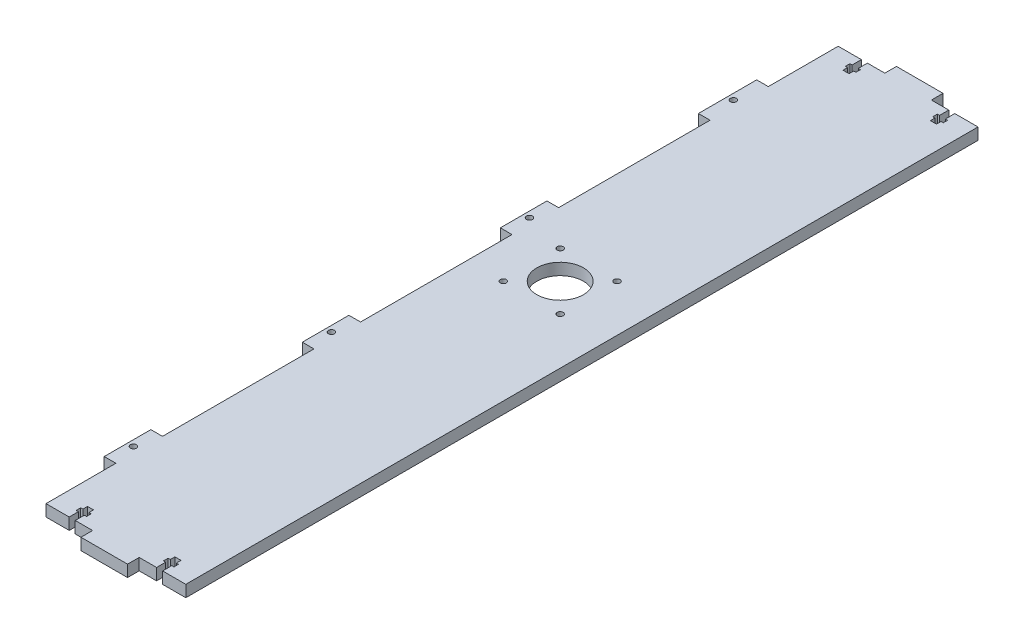
from build123d import *

# Parameters (mm, degrees)
SKETCH1_R           = 1.65
SKETCH1_R_2         = 12.7
BOSS_EXTRUDE1_DEPTH = 6.35


with BuildPart() as part:
    # Sketch1 → Boss-Extrude1 (new body)
    with BuildSketch(Plane.XZ.offset(-50.8)):
        Polygon((-350.52, 222.25), (-350.52, 215.9), (-359.9825, 215.9), (-359.9825, 210.9), (-358.7825, 210.9), (-358.7825, 208.4), (-359.9825, 208.4), (-359.9825, 205.9), (-363.2825, 205.9), (-363.2825, 208.4), (-364.4825, 208.4), (-364.4825, 210.9), (-363.2825, 210.9), (-363.2825, 215.9), (-375.92, 215.9), (-375.92, 177.8), (-382.27, 177.8), (-382.27, 152.4), (-375.92, 152.4), (-375.92, 69.85), (-382.27, 69.85), (-382.27, 44.45), (-375.92, 44.45), (-375.92, -38.1), (-382.27, -38.1), (-382.27, -63.5), (-375.92, -63.5), (-375.92, -146.05), (-382.27, -146.05), (-382.27, -177.8), (-375.92, -177.8), (-375.92, -215.9), (-363.2825, -215.9), (-363.2825, -210.9), (-364.4825, -210.9), (-364.4825, -208.4), (-363.2825, -208.4), (-363.2825, -205.9), (-359.9825, -205.9), (-359.9825, -208.4), (-358.7825, -208.4), (-358.7825, -210.9), (-359.9825, -210.9), (-359.9825, -215.9), (-350.52, -215.9), (-350.52, -222.25), (-325.12, -222.25), (-325.12, -215.9), (-315.6575, -215.9), (-315.6575, -210.9), (-316.8575, -210.9), (-316.8575, -208.4), (-315.6575, -208.4), (-315.6575, -205.9), (-312.3575, -205.9), (-312.3575, -208.4), (-311.1575, -208.4), (-311.1575, -210.9), (-312.3575, -210.9), (-312.3575, -215.9), (-299.72, -215.9), (-299.72, 215.9), (-312.3575, 215.9), (-312.3575, 210.9), (-311.1575, 210.9), (-311.1575, 208.4), (-312.3575, 208.4), (-312.3575, 205.9), (-315.6575, 205.9), (-315.6575, 208.4), (-316.8575, 208.4), (-316.8575, 210.9), (-315.6575, 210.9), (-315.6575, 215.9), (-325.12, 215.9), (-325.12, 222.25), align=None)
        with Locations((-379.095, 165.1)):
            Circle(SKETCH1_R, mode=Mode.SUBTRACT)
        with Locations((-379.095, 57.15)):
            Circle(SKETCH1_R, mode=Mode.SUBTRACT)
        with Locations((-379.095, -161.925)):
            Circle(SKETCH1_R, mode=Mode.SUBTRACT)
        with Locations((-379.095, -50.8)):
            Circle(SKETCH1_R, mode=Mode.SUBTRACT)
        with Locations((-325.259000014, -13.688281448)):
            Circle(SKETCH1_R, mode=Mode.SUBTRACT)
        with Locations((-356.259000014, -13.688281448)):
            Circle(SKETCH1_R, mode=Mode.SUBTRACT)
        with Locations((-325.259000014, -44.688281448)):
            Circle(SKETCH1_R, mode=Mode.SUBTRACT)
        with Locations((-356.259000014, -44.688281448)):
            Circle(SKETCH1_R, mode=Mode.SUBTRACT)
        with Locations((-340.759000014, -29.188281448)):
            Circle(SKETCH1_R_2, mode=Mode.SUBTRACT)
    extrude(amount=-BOSS_EXTRUDE1_DEPTH)


solid = part.part
